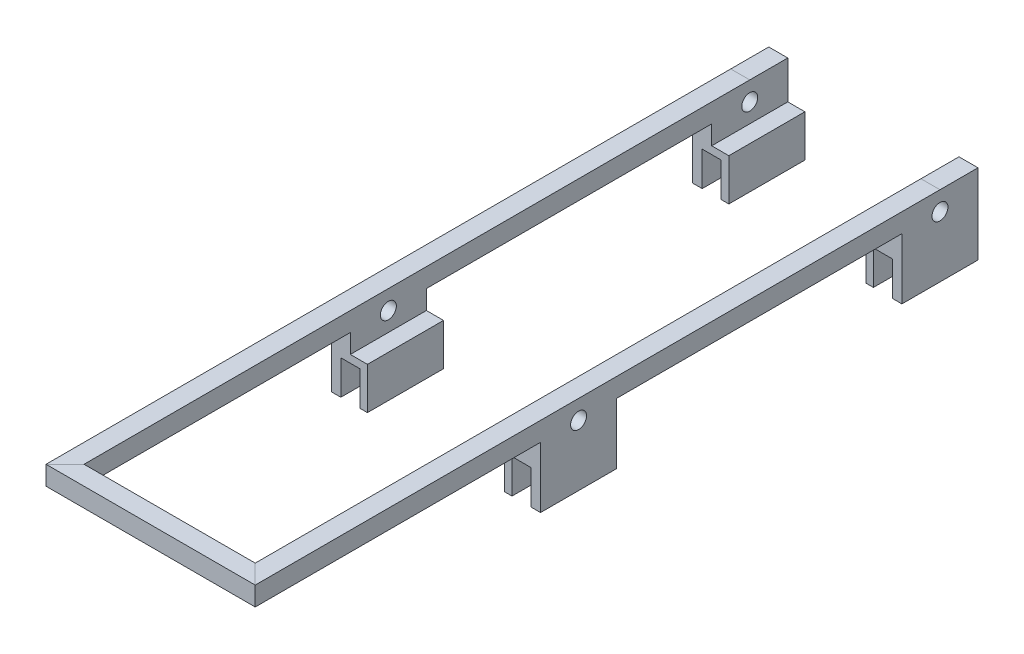
from build123d import *

# Parameters (mm, degrees)
RAIL_PROFILE_W          = 6.35
RAIL_PROFILE_H          = 6.35
BACKCLIP_DEPTH          = 12.7
FRONTCLIP_DEPTH         = 12.7
CUT_EXTRUDE1_DEPTH      = 141.633506054
CUT_EXTRUDE1_DEPTH_BACK = 141.633506054
SKETCH8_R               = 2.667


with BuildPart() as part:
    # Sweep1: sweep along a path in rail_path
    with BuildLine(Plane(origin=(0, 0, 0), x_dir=(1, 0, 0), z_dir=(0, 1, 0))) as sweep1_path:
        Line((28.575, 123.825), (28.575, 111.125))
        Line((28.575, 111.125), (28.575, -111.125))
        Line((28.575, -111.125), (-28.575, -111.125))
        Line((-28.575, -111.125), (-28.575, 111.125))
        Line((-28.575, 111.125), (-28.575, 123.825))
    # rail_profile → Sweep1 (sweep)
    with BuildSketch(Plane.XY):
        with Locations((31.75, 3.175)):
            Rectangle(RAIL_PROFILE_W, RAIL_PROFILE_H)
    sweep(path=sweep1_path.line, transition=Transition.RIGHT)

    # BackClipProfile → BackClip (add, symmetric)
    with BuildSketch(Plane(origin=(0, 0, 9.525), x_dir=(-1, 0, 0), z_dir=(0, 0, -1))):
        Polygon((-34.925, 0), (-28.575, 0), (-28.575, -6.35), (-22.86, -6.35), (-22.86, -20.32), (-25.4, -20.32), (-25.4, -8.89), (-31.75, -8.89), (-31.75, -20.32), (-34.925, -20.32), (-34.925, -6.35), align=None)
    backclip = extrude(amount=BACKCLIP_DEPTH, both=True)

    # BackClipMirror: BackClip across plane
    add(backclip.mirror(Plane(origin=(0, 0, 0), x_dir=(0, 0, 1), z_dir=(1, 0, 0))))

    # FrontClipProfile → FrontClip (add, symmetric)
    with BuildSketch(Plane(origin=(0, 0, -111.125), x_dir=(-1, 0, 0), z_dir=(0, 0, -1))):
        Polygon((-34.925, -20.32), (-31.75, -20.32), (-31.75, -8.89), (-25.4, -8.89), (-25.4, -20.32), (-22.86, -20.32), (-22.86, -6.35), (-28.575, -6.35), (-28.575, 0), (-34.925, 0), (-34.925, -6.35), align=None)
    frontclip = extrude(amount=FRONTCLIP_DEPTH, both=True)

    # FrontClipMirror: FrontClip across plane
    add(frontclip.mirror(Plane(origin=(0, 0, 0), x_dir=(0, 0, 1), z_dir=(1, 0, 0))))

    # Sketch8 → Cut-Extrude1 (cut, two sides: drawn at the far end of the back side and taken through both)
    with BuildSketch(Plane.ZY.offset(-28.575).offset(-CUT_EXTRUDE1_DEPTH_BACK)):
        with Locations((-111.125, 0)):
            Circle(SKETCH8_R)
        with Locations((9.525, 0)):
            Circle(SKETCH8_R)
    extrude(amount=CUT_EXTRUDE1_DEPTH + CUT_EXTRUDE1_DEPTH_BACK, mode=Mode.SUBTRACT)


solid = part.part
